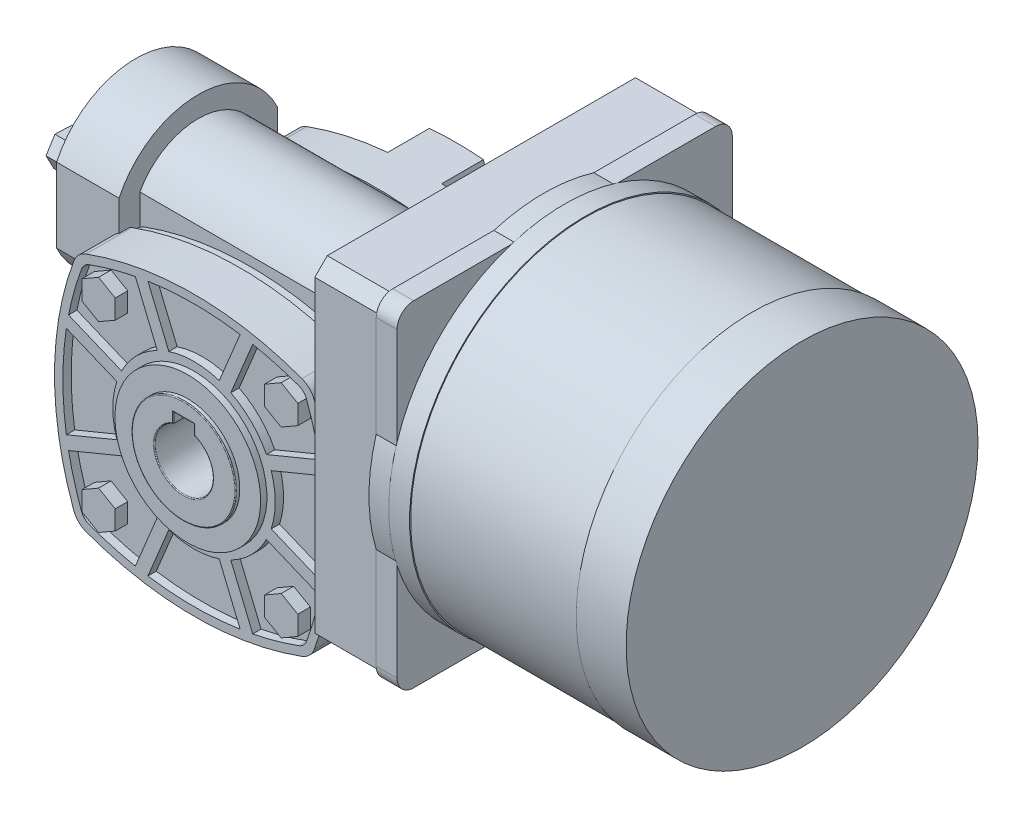
from build123d import *
from build123d.topology import SkipClean

# Parameters (mm, degrees)
SCHIZZO1_R               = 7
ESTRUSIONE1_DEPTH        = 25.5
SCHIZZO2_R               = 7
ESTRUSIONE2_DEPTH        = 10
TAGLIO_ESTRUSIONE1_START = -10
SCHIZZO3_R               = 2.5
SCHIZZO3_R_2             = 21
SCHIZZO3_R_3             = 7
TAGLIO_ESTRUSIONE1_DEPTH = 10
ESTRUSIONE3_START        = 6
SCHIZZO4_R               = 12.5
SCHIZZO4_R_2             = 7
ESTRUSIONE3_DEPTH        = 6
SCHIZZO5_W               = 5
SCHIZZO5_H               = 9
TAGLIO_ESTRUSIONE2_DEPTH = 75.118148925
RACCORDO1_R              = 0.2
ESTRUSIONE4_DEPTH        = 3
SCHIZZO7_R               = 17.5
SCHIZZO7_R_2             = 12.5
ESTRUSIONE5_DEPTH        = 3.5
SCHIZZO8_R               = 12.5
ESTRUSIONE6_DEPTH        = 4.5
RACCORDO2_R              = 0.2
ESTRUSIONE7_START        = 2
SCHIZZO9_R               = 17.5
ESTRUSIONE7_DEPTH        = 2
TAGLIO_ESTRUSIONE3_START = -1.5
TAGLIO_ESTRUSIONE3_DEPTH = 15
TAGLIO_ESTRUSIONE4_START = 16.5
TAGLIO_ESTRUSIONE4_DEPTH = 15
ESTRUSIONE8_DEPTH        = 41.5
ESTRUSIONE8_DEPTH_BACK   = 41.5
ESTRUSIONE9_DEPTH        = 15
ESTRUSIONE10_DEPTH       = 15
SMUSSO1_SIZE             = 3
ESTRUSIONE11_DEPTH       = 3
ESTRUSIONE12_DEPTH       = 3
ESTRUSIONE13_DEPTH       = 15
SCHIZZO20_R              = 42
ESTRUSIONE14_DEPTH       = 62
ESTRUSIONE16_DEPTH       = 5
SCHIZZO23_R              = 42.25
ESTRUSIONE17_DEPTH       = 5
ESTRUSIONE18_START       = -12
SCHIZZO24_R              = 42.25
ESTRUSIONE18_DEPTH       = 12


# Some blends are built 0.0001 mm under size
with BuildPart() as part:
    # Schizzo1 → Estrusione1 (new, symmetric)
    with BuildSketch(Plane.XY):
        with BuildLine():
            ThreePointArc((25.915877081, 28.880162795), (0, 33.5), (-25.915877081, 28.880162795))
            ThreePointArc((-25.915877081, 28.880162795), (-27.723685848, 27.723685848), (-28.880162795, 25.915877081))
            ThreePointArc((-28.880162795, 25.915877081), (-33.5, 0), (-28.880162795, -25.915877081))
            ThreePointArc((-28.880162795, -25.915877081), (-27.723685848, -27.723685848), (-25.915877081, -28.880162795))
            ThreePointArc((-25.915877081, -28.880162795), (0, -33.5), (25.915877081, -28.880162795))
            ThreePointArc((25.915877081, -28.880162795), (27.723685848, -27.723685848), (28.880162795, -25.915877081))
            ThreePointArc((28.880162795, -25.915877081), (33.5, 0), (28.880162795, 25.915877081))
            ThreePointArc((28.880162795, 25.915877081), (27.723685848, 27.723685848), (25.915877081, 28.880162795))
        make_face()
        Circle(SCHIZZO1_R, mode=Mode.SUBTRACT)
    extrude(amount=ESTRUSIONE1_DEPTH, both=True)

    # Schizzo2 → Estrusione2 (add)
    with BuildSketch(Plane(origin=(0, 0, -25.5), x_dir=(-1, 0, 0), z_dir=(0, 0, -1))):
        with BuildLine():
            ThreePointArc((28.880162795, 25.915877081), (27.723685848, 27.723685848), (25.915877081, 28.880162795))
            ThreePointArc((25.915877081, 28.880162795), (0, 33.5), (-25.915877081, 28.880162795))
            ThreePointArc((-25.915877081, 28.880162795), (-27.723685848, 27.723685848), (-28.880162795, 25.915877081))
            ThreePointArc((-28.880162795, 25.915877081), (-33.5, 0), (-28.880162795, -25.915877081))
            ThreePointArc((-28.880162795, -25.915877081), (-27.723685848, -27.723685848), (-25.915877081, -28.880162795))
            ThreePointArc((-25.915877081, -28.880162795), (0, -33.5), (25.915877081, -28.880162795))
            ThreePointArc((25.915877081, -28.880162795), (27.723685848, -27.723685848), (28.880162795, -25.915877081))
            ThreePointArc((28.880162795, -25.915877081), (33.5, 0), (28.880162795, 25.915877081))
        make_face()
        Circle(SCHIZZO2_R, mode=Mode.SUBTRACT)
    extrude(amount=ESTRUSIONE2_DEPTH)

    # Schizzo3 → Taglio-Estrusione1 (cut)
    # profile 1 of 9: a face of its own
    with BuildSketch(Plane(origin=(0, 0, -35.5), x_dir=(-1, 0, 0), z_dir=(0, 0, -1)).offset(TAGLIO_ESTRUSIONE1_START)):
        with Locations((0, 27.5)):
            Circle(SCHIZZO3_R)
    # profile 2 of 9: a face of its own
    with BuildSketch(Plane(origin=(0, 0, -35.5), x_dir=(-1, 0, 0), z_dir=(0, 0, -1)).offset(TAGLIO_ESTRUSIONE1_START)):
        with Locations(Location((0, -27.5, 0), (0, 0, 180))):
            Circle(SCHIZZO3_R)
    # profile 3 of 9: a face of its own
    with BuildSketch(Plane(origin=(0, 0, -35.5), x_dir=(-1, 0, 0), z_dir=(0, 0, -1)).offset(TAGLIO_ESTRUSIONE1_START)):
        with Locations((-27.5, 0)):
            Circle(SCHIZZO3_R)
    # profile 4 of 9: a face of its own
    with BuildSketch(Plane(origin=(0, 0, -35.5), x_dir=(-1, 0, 0), z_dir=(0, 0, -1)).offset(TAGLIO_ESTRUSIONE1_START)):
        with Locations(Location((27.5, 0, 0), (0, 0, 180))):
            Circle(SCHIZZO3_R)
    # profile 5 of 9: a face of its own
    with BuildSketch(Plane(origin=(0, 0, -35.5), x_dir=(-1, 0, 0), z_dir=(0, 0, -1)).offset(TAGLIO_ESTRUSIONE1_START)):
        Circle(SCHIZZO3_R_2)
        Circle(SCHIZZO3_R_3, mode=Mode.SUBTRACT)
    # profile 6 of 9: a face of its own
    with BuildSketch(Plane(origin=(0, 0, -35.5), x_dir=(-1, 0, 0), z_dir=(0, 0, -1)).offset(TAGLIO_ESTRUSIONE1_START)):
        with BuildLine():
            Line((-6.5, 33.21780243), (-9.828937879, 20.79403713))
            ThreePointArc((-9.828937879, 20.79403713), (-16.263455967, 16.263455967), (-20.79403713, 9.828937879))
            Line((-20.79403713, 9.828937879), (-33.21780243, 6.5))
            ThreePointArc((-33.21780243, 6.5), (-31.695621104, 16.352401999), (-28.880162795, 25.915877081))
            ThreePointArc((-28.880162795, 25.915877081), (-27.723685848, 27.723685848), (-25.915877081, 28.880162795))
            ThreePointArc((-25.915877081, 28.880162795), (-16.352401999, 31.695621104), (-6.5, 33.21780243))
        make_face()
    # profile 7 of 9: a face of its own
    with BuildSketch(Plane(origin=(0, 0, -35.5), x_dir=(-1, 0, 0), z_dir=(0, 0, -1)).offset(TAGLIO_ESTRUSIONE1_START)):
        with BuildLine():
            Line((6.5, 33.21780243), (9.828937879, 20.79403713))
            ThreePointArc((9.828937879, 20.79403713), (16.263455967, 16.263455967), (20.79403713, 9.828937879))
            Line((20.79403713, 9.828937879), (33.21780243, 6.5))
            ThreePointArc((33.21780243, 6.5), (31.695621104, 16.352401999), (28.880162795, 25.915877081))
            ThreePointArc((28.880162795, 25.915877081), (27.723685848, 27.723685848), (25.915877081, 28.880162795))
            ThreePointArc((25.915877081, 28.880162795), (16.352401999, 31.695621104), (6.5, 33.21780243))
        make_face()
    # profile 8 of 9: a face of its own
    with BuildSketch(Plane(origin=(0, 0, -35.5), x_dir=(-1, 0, 0), z_dir=(0, 0, -1)).offset(TAGLIO_ESTRUSIONE1_START)):
        with BuildLine():
            Line((-6.5, -33.21780243), (-9.828937879, -20.79403713))
            ThreePointArc((-9.828937879, -20.79403713), (-16.263455967, -16.263455967), (-20.79403713, -9.828937879))
            Line((-20.79403713, -9.828937879), (-33.21780243, -6.5))
            ThreePointArc((-33.21780243, -6.5), (-31.695621104, -16.352401999), (-28.880162795, -25.915877081))
            ThreePointArc((-28.880162795, -25.915877081), (-27.723685848, -27.723685848), (-25.915877081, -28.880162795))
            ThreePointArc((-25.915877081, -28.880162795), (-16.352401999, -31.695621104), (-6.5, -33.21780243))
        make_face()
    # profile 9 of 9: a face of its own
    with BuildSketch(Plane(origin=(0, 0, -35.5), x_dir=(-1, 0, 0), z_dir=(0, 0, -1)).offset(TAGLIO_ESTRUSIONE1_START)):
        with BuildLine():
            Line((6.5, -33.21780243), (9.828937879, -20.79403713))
            ThreePointArc((9.828937879, -20.79403713), (16.263455967, -16.263455967), (20.79403713, -9.828937879))
            Line((20.79403713, -9.828937879), (33.21780243, -6.5))
            ThreePointArc((33.21780243, -6.5), (31.695621104, -16.352401999), (28.880162795, -25.915877081))
            ThreePointArc((28.880162795, -25.915877081), (27.723685848, -27.723685848), (25.915877081, -28.880162795))
            ThreePointArc((25.915877081, -28.880162795), (16.352401999, -31.695621104), (6.5, -33.21780243))
        make_face()
    extrude(amount=TAGLIO_ESTRUSIONE1_DEPTH, mode=Mode.SUBTRACT)

    # Schizzo4 → Estrusione3 (add)
    with SkipClean():  # the faces are left unmerged after this step: merging them gives an invalid solid
        with BuildSketch(Plane(origin=(0, 0, -25.5), x_dir=(-1, 0, 0), z_dir=(0, 0, -1)).offset(ESTRUSIONE3_START)):
            Circle(SCHIZZO4_R)
            Circle(SCHIZZO4_R_2, mode=Mode.SUBTRACT)
        extrude(amount=-ESTRUSIONE3_DEPTH)

    # Schizzo5 → Taglio-Estrusione2 (cut, through all)
    with SkipClean():  # the faces are left unmerged after this step: merging them gives an invalid solid
        with BuildSketch(Plane(origin=(0, 0, -31.5), x_dir=(-1, 0, 0), z_dir=(0, 0, -1))):
            with Locations((0, 4.5)):
                Rectangle(SCHIZZO5_W, SCHIZZO5_H)
        extrude(amount=-TAGLIO_ESTRUSIONE2_DEPTH, mode=Mode.SUBTRACT)
    add(part.part.scale(1), mode=Mode.REPLACE)  # the faces are merged on a copy

    # Raccordo1
    raccordo1_edges = [part.edges().sort_by_distance(p)[0] for p in [
        (12.5, 0, -31.5),
        (3.968626967, -5.766281297, -31.5),
    ]]
    fillet(raccordo1_edges, radius=RACCORDO1_R)

    # Schizzo6 → Estrusione4 (add)
    with BuildSketch(Plane(origin=(0, 0, -25.5), x_dir=(-1, 0, 0), z_dir=(0, 0, -1))):
        Polygon((25.920310217, 19.61090914), (21.920310217, 17.301508063), (17.920310217, 19.61090914), (17.920310217, 24.229711294), (21.920310217, 26.53911237), (25.920310217, 24.229711294), align=None)
        Polygon((-21.920310217, 17.301508063), (-17.920310217, 19.61090914), (-17.920310217, 24.229711294), (-21.920310217, 26.53911237), (-25.920310217, 24.229711294), (-25.920310217, 19.61090914), align=None)
        Polygon((21.920310217, -17.301508063), (17.920310217, -19.61090914), (17.920310217, -24.229711294), (21.920310217, -26.53911237), (25.920310217, -24.229711294), (25.920310217, -19.61090914), align=None)
        Polygon((-25.920310217, -19.61090914), (-21.920310217, -17.301508063), (-17.920310217, -19.61090914), (-17.920310217, -24.229711294), (-21.920310217, -26.53911237), (-25.920310217, -24.229711294), align=None)
    extrude(amount=ESTRUSIONE4_DEPTH)

    # Schizzo7 → Estrusione5 (add)
    with BuildSketch(Plane.XY.offset(25.5)):
        with Locations(Location((0, 0, 0), (0, 0, 180))):
            Circle(SCHIZZO7_R)
        with Locations(Location((0, 0, 0), (0, 0, 180))):
            Circle(SCHIZZO7_R_2, mode=Mode.SUBTRACT)
    extrude(amount=ESTRUSIONE5_DEPTH)

    # Schizzo8 → Estrusione6 (add)
    with BuildSketch(Plane.XY.offset(25.5)):
        with Locations(Location((0, 0, 0), (0, 0, 180))):
            Circle(SCHIZZO8_R)
        with BuildLine():
            Line((2.5, 9), (2.5, 6.538348415))
            ThreePointArc((2.5, 6.538348415), (0, -7), (-2.5, 6.538348415))
            Line((-2.5, 6.538348415), (-2.5, 9))
            Line((-2.5, 9), (2.5, 9))
        make_face(mode=Mode.SUBTRACT)
    extrude(amount=ESTRUSIONE6_DEPTH)

    # Raccordo2
    # the kernel refuses this fillet: 0.2 mm, written as the material it takes off along each edge
    with BuildSketch(Plane(origin=(0, 0, 30), x_dir=(-1, 0, 0), z_dir=(0, 1, 0))) as raccordo2_piece_1:
        with BuildLine():
            CenterArc((12.5 - RACCORDO2_R, -RACCORDO2_R), RACCORDO2_R, 0, 90)
            Line((12.5, -RACCORDO2_R), (12.5, 0))
            Line((12.5, 0), (12.5 - RACCORDO2_R, 0))
        make_face()
    revolve(axis=Axis((0, 0, 30), (0, 0, 1)), mode=Mode.SUBTRACT)
    with BuildSketch(Plane(origin=(-2.5, 9, 30), x_dir=(0, 0, -1), z_dir=(1, 0, 0))) as raccordo2_piece_2:
        with BuildLine():
            CenterArc((RACCORDO2_R, RACCORDO2_R), RACCORDO2_R, 180, 90)
            Line((0, RACCORDO2_R), (0, 0))
            Line((0, 0), (RACCORDO2_R, 0))
        make_face()
    extrude(amount=5, mode=Mode.SUBTRACT)
    with BuildSketch(Plane(origin=(-2.5, 6.038348415, 30), x_dir=(0, 0, -1), z_dir=(0, 1, 0)), Plane(origin=(2.5, 9, 30), x_dir=(0, 0, -1), z_dir=(0, -1, 0))) as raccordo2_piece_3:
        with BuildLine():
            CenterArc((RACCORDO2_R, RACCORDO2_R), RACCORDO2_R, 180, 90)
            Line((0, RACCORDO2_R), (0, 0))
            Line((0, 0), (RACCORDO2_R, 0))
        make_face()
    extrude(amount=2.961651585, mode=Mode.SUBTRACT)
    with BuildSketch(Plane(origin=(0, 0, 30), x_dir=(0.2892267133051711, 0.9572606271599644, 0), z_dir=(-0.9572606271599644, 0.2892267133051711, 0))) as raccordo2_piece_4:
        with BuildLine():
            CenterArc((7 + RACCORDO2_R, RACCORDO2_R), RACCORDO2_R, 180, 90)
            Line((7, RACCORDO2_R), (7, 0))
            Line((7, 0), (7 + RACCORDO2_R, 0))
        make_face()
    revolve(axis=Axis((0, 0, 30), (0, 0, -1)), revolution_arc=326.37666771, mode=Mode.SUBTRACT)
    with BuildSketch(Plane(origin=(-3, 9, 30), x_dir=(0, 0, -1), z_dir=(1, 0, 0))) as raccordo2_piece_5a_section:
        with BuildLine():
            CenterArc((RACCORDO2_R, RACCORDO2_R), RACCORDO2_R, 180, 90)
            Line((0, RACCORDO2_R), (0, 0))
            Line((0, 0), (RACCORDO2_R, 0))
        make_face()
    raccordo2_piece_5a = extrude(amount=5.5, mode=Mode.PRIVATE)
    raccordo2_piece_5a = split(raccordo2_piece_5a, bisect_by=Plane(origin=(-2.5, 9.045279023, 29.954720977), z_dir=(-1, 0, 0)), keep=Keep.TOP, mode=Mode.PRIVATE)
    with BuildSketch(Plane(origin=(-2.5, 6.038348415, 30), x_dir=(0, 0, -1), z_dir=(0, 1, 0))) as raccordo2_piece_5b_section:
        with BuildLine():
            CenterArc((RACCORDO2_R, RACCORDO2_R), RACCORDO2_R, 180, 90)
            Line((0, RACCORDO2_R), (0, 0))
            Line((0, 0), (RACCORDO2_R, 0))
        make_face()
    raccordo2_piece_5b = extrude(amount=3.461651585, mode=Mode.PRIVATE)
    raccordo2_piece_5b = split(raccordo2_piece_5b, bisect_by=Plane(origin=(-2.545279023, 9, 29.954720977), z_dir=(0, 1, 0)), keep=Keep.TOP, mode=Mode.PRIVATE)
    raccordo2_piece_5 = raccordo2_piece_5a & raccordo2_piece_5b
    add(raccordo2_piece_5, mode=Mode.SUBTRACT)
    with BuildSketch(Plane(origin=(2.5, 9.5, 30), x_dir=(0, 0, -1), z_dir=(0, -1, 0))) as raccordo2_piece_6a_section:
        with BuildLine():
            CenterArc((RACCORDO2_R, RACCORDO2_R), RACCORDO2_R, 180, 90)
            Line((0, RACCORDO2_R), (0, 0))
            Line((0, 0), (RACCORDO2_R, 0))
        make_face()
    raccordo2_piece_6a = extrude(amount=3.461651585, mode=Mode.PRIVATE)
    raccordo2_piece_6a = split(raccordo2_piece_6a, bisect_by=Plane(origin=(2.545279023, 9, 29.954720977), z_dir=(0, 1, 0)), keep=Keep.TOP, mode=Mode.PRIVATE)
    with BuildSketch(Plane(origin=(-2.5, 9, 30), x_dir=(0, 0, -1), z_dir=(1, 0, 0))) as raccordo2_piece_6b_section:
        with BuildLine():
            CenterArc((RACCORDO2_R, RACCORDO2_R), RACCORDO2_R, 180, 90)
            Line((0, RACCORDO2_R), (0, 0))
            Line((0, 0), (RACCORDO2_R, 0))
        make_face()
    raccordo2_piece_6b = extrude(amount=5.5, mode=Mode.PRIVATE)
    raccordo2_piece_6b = split(raccordo2_piece_6b, bisect_by=Plane(origin=(2.5, 9.045279023, 29.954720977), z_dir=(1, 0, 0)), keep=Keep.TOP, mode=Mode.PRIVATE)
    raccordo2_piece_6 = raccordo2_piece_6a & raccordo2_piece_6b
    add(raccordo2_piece_6, mode=Mode.SUBTRACT)

    # Schizzo9 → Estrusione7 (add)
    with BuildSketch(Plane.XY.offset(25.5).offset(ESTRUSIONE7_START)):
        with BuildLine():
            ThreePointArc((-25.915877081, 28.880162795), (-27.723685848, 27.723685848), (-28.880162795, 25.915877081))
            ThreePointArc((-28.880162795, 25.915877081), (-33.5, 0), (-28.880162795, -25.915877081))
            ThreePointArc((-28.880162795, -25.915877081), (-27.723685848, -27.723685848), (-25.915877081, -28.880162795))
            ThreePointArc((-25.915877081, -28.880162795), (0, -33.5), (25.915877081, -28.880162795))
            ThreePointArc((25.915877081, -28.880162795), (27.723685848, -27.723685848), (28.880162795, -25.915877081))
            ThreePointArc((28.880162795, -25.915877081), (33.5, 0), (28.880162795, 25.915877081))
            ThreePointArc((28.880162795, 25.915877081), (27.723685848, 27.723685848), (25.915877081, 28.880162795))
            ThreePointArc((25.915877081, 28.880162795), (0, 33.5), (-25.915877081, 28.880162795))
        make_face()
        Circle(SCHIZZO9_R, mode=Mode.SUBTRACT)
        with BuildLine():
            Line((-14.101770277, 30.124996161), (-8.826035583, 17.388245912))
            ThreePointArc((-8.826035583, 17.388245912), (-13.788582233, 13.788582233), (-17.388245912, 8.826035583))
            Line((-17.388245912, 8.826035583), (-30.124996161, 14.101770277))
            ThreePointArc((-30.124996161, 14.101770277), (-28.784559593, 19.725128208), (-27.003358454, 25.224787026))
            ThreePointArc((-27.003358454, 25.224787026), (-26.309472286, 26.309472286), (-25.224787026, 27.003358454))
            ThreePointArc((-25.224787026, 27.003358454), (-19.725128208, 28.784559593), (-14.101770277, 30.124996161))
        make_face(mode=Mode.SUBTRACT)
        with BuildLine():
            Line((11.074181495, 30.655128052), (6.054396985, 18.536296209))
            ThreePointArc((6.054396985, 18.536296209), (0, 19.5), (-6.054396985, 18.536296209))
            Line((-6.054396985, 18.536296209), (-11.074181495, 30.655128052))
            ThreePointArc((-11.074181495, 30.655128052), (0, 31.5), (11.074181495, 30.655128052))
        make_face(mode=Mode.SUBTRACT)
        with BuildLine():
            Line((14.101770277, 30.124996161), (8.826035583, 17.388245912))
            ThreePointArc((8.826035583, 17.388245912), (13.788582233, 13.788582233), (17.388245912, 8.826035583))
            Line((17.388245912, 8.826035583), (30.124996161, 14.101770277))
            ThreePointArc((30.124996161, 14.101770277), (28.784559593, 19.725128208), (27.003358454, 25.224787026))
            ThreePointArc((27.003358454, 25.224787026), (26.309472286, 26.309472286), (25.224787026, 27.003358454))
            ThreePointArc((25.224787026, 27.003358454), (19.725128208, 28.784559593), (14.101770277, 30.124996161))
        make_face(mode=Mode.SUBTRACT)
        with BuildLine():
            Line((14.101770277, -30.124996161), (8.826035583, -17.388245912))
            ThreePointArc((8.826035583, -17.388245912), (13.788582233, -13.788582233), (17.388245912, -8.826035583))
            Line((17.388245912, -8.826035583), (30.124996161, -14.101770277))
            ThreePointArc((30.124996161, -14.101770277), (28.784559593, -19.725128208), (27.003358454, -25.224787026))
            ThreePointArc((27.003358454, -25.224787026), (26.309472286, -26.309472286), (25.224787026, -27.003358454))
            ThreePointArc((25.224787026, -27.003358454), (19.725128208, -28.784559593), (14.101770277, -30.124996161))
        make_face(mode=Mode.SUBTRACT)
        with BuildLine():
            Line((-11.074181495, -30.655128052), (-6.054396985, -18.536296209))
            ThreePointArc((-6.054396985, -18.536296209), (0, -19.5), (6.054396985, -18.536296209))
            Line((6.054396985, -18.536296209), (11.074181495, -30.655128052))
            ThreePointArc((11.074181495, -30.655128052), (0, -31.5), (-11.074181495, -30.655128052))
        make_face(mode=Mode.SUBTRACT)
        with BuildLine():
            Line((-14.101770277, -30.124996161), (-8.826035583, -17.388245912))
            ThreePointArc((-8.826035583, -17.388245912), (-13.788582233, -13.788582233), (-17.388245912, -8.826035583))
            Line((-17.388245912, -8.826035583), (-30.124996161, -14.101770277))
            ThreePointArc((-30.124996161, -14.101770277), (-28.784559593, -19.725128208), (-27.003358454, -25.224787026))
            ThreePointArc((-27.003358454, -25.224787026), (-26.309472286, -26.309472286), (-25.224787026, -27.003358454))
            ThreePointArc((-25.224787026, -27.003358454), (-19.725128208, -28.784559593), (-14.101770277, -30.124996161))
        make_face(mode=Mode.SUBTRACT)
        with BuildLine():
            Line((-30.655128052, 11.074181495), (-18.536296209, 6.054396985))
            ThreePointArc((-18.536296209, 6.054396985), (-19.5, 0), (-18.536296209, -6.054396985))
            Line((-18.536296209, -6.054396985), (-30.655128052, -11.074181495))
            ThreePointArc((-30.655128052, -11.074181495), (-31.5, 0), (-30.655128052, 11.074181495))
        make_face(mode=Mode.SUBTRACT)
        with BuildLine():
            Line((30.655128052, -11.074181495), (18.536296209, -6.054396985))
            ThreePointArc((18.536296209, -6.054396985), (19.5, 0), (18.536296209, 6.054396985))
            Line((18.536296209, 6.054396985), (30.655128052, 11.074181495))
            ThreePointArc((30.655128052, 11.074181495), (31.5, 0), (30.655128052, -11.074181495))
        make_face(mode=Mode.SUBTRACT)
    extrude(amount=-ESTRUSIONE7_DEPTH)

    # Schizzo11 → Taglio-Estrusione3 (cut)
    with BuildSketch(Plane.XY.offset(TAGLIO_ESTRUSIONE3_START)):
        with BuildLine():
            ThreePointArc((36.627772941, 57.970630084), (0, 64.5), (-36.627772941, 57.970630084))
            ThreePointArc((-36.627772941, 57.970630084), (-49.643996065, 49.643996065), (-57.970630084, 36.627772941))
            ThreePointArc((-57.970630084, 36.627772941), (-64.5, 0), (-57.970630084, -36.627772941))
            ThreePointArc((-57.970630084, -36.627772941), (-49.643996065, -49.643996065), (-36.627772941, -57.970630084))
            ThreePointArc((-36.627772941, -57.970630084), (0, -64.5), (36.627772941, -57.970630084))
            ThreePointArc((36.627772941, -57.970630084), (49.643996065, -49.643996065), (57.970630084, -36.627772941))
            ThreePointArc((57.970630084, -36.627772941), (64.5, 0), (57.970630084, 36.627772941))
            ThreePointArc((57.970630084, 36.627772941), (49.643996065, 49.643996065), (36.627772941, 57.970630084))
        make_face()
        with BuildLine():
            ThreePointArc((25.570332053, 27.941760625), (0, 32.5), (-25.570332053, 27.941760625))
            ThreePointArc((-25.570332053, 27.941760625), (-27.016579067, 27.016579067), (-27.941760625, 25.570332053))
            ThreePointArc((-27.941760625, 25.570332053), (-32.5, 0), (-27.941760625, -25.570332053))
            ThreePointArc((-27.941760625, -25.570332053), (-27.016579067, -27.016579067), (-25.570332053, -27.941760625))
            ThreePointArc((-25.570332053, -27.941760625), (0, -32.5), (25.570332053, -27.941760625))
            ThreePointArc((25.570332053, -27.941760625), (27.016579067, -27.016579067), (27.941760625, -25.570332053))
            ThreePointArc((27.941760625, -25.570332053), (32.5, 0), (27.941760625, 25.570332053))
            ThreePointArc((27.941760625, 25.570332053), (27.016579067, 27.016579067), (25.570332053, 27.941760625))
        make_face(mode=Mode.SUBTRACT)
    extrude(amount=-TAGLIO_ESTRUSIONE3_DEPTH, mode=Mode.SUBTRACT)

    # Schizzo12 → Taglio-Estrusione4 (cut)
    with BuildSketch(Plane.XY.offset(TAGLIO_ESTRUSIONE4_START)):
        with BuildLine():
            ThreePointArc((29.716872386, 39.202586672), (0, 44.5), (-29.716872386, 39.202586672))
            ThreePointArc((-29.716872386, 39.202586672), (-35.501860441, 35.501860441), (-39.202586672, 29.716872386))
            ThreePointArc((-39.202586672, 29.716872386), (-44.5, 0), (-39.202586672, -29.716872386))
            ThreePointArc((-39.202586672, -29.716872386), (-35.501860441, -35.501860441), (-29.716872386, -39.202586672))
            ThreePointArc((-29.716872386, -39.202586672), (0, -44.5), (29.716872386, -39.202586672))
            ThreePointArc((29.716872386, -39.202586672), (35.501860441, -35.501860441), (39.202586672, -29.716872386))
            ThreePointArc((39.202586672, -29.716872386), (44.5, 0), (39.202586672, 29.716872386))
            ThreePointArc((39.202586672, 29.716872386), (35.501860441, 35.501860441), (29.716872386, 39.202586672))
        make_face()
        with BuildLine():
            ThreePointArc((25.570332053, 27.941760625), (0, 32.5), (-25.570332053, 27.941760625))
            ThreePointArc((-25.570332053, 27.941760625), (-27.016579067, 27.016579067), (-27.941760625, 25.570332053))
            ThreePointArc((-27.941760625, 25.570332053), (-32.5, 0), (-27.941760625, -25.570332053))
            ThreePointArc((-27.941760625, -25.570332053), (-27.016579067, -27.016579067), (-25.570332053, -27.941760625))
            ThreePointArc((-25.570332053, -27.941760625), (0, -32.5), (25.570332053, -27.941760625))
            ThreePointArc((25.570332053, -27.941760625), (27.016579067, -27.016579067), (27.941760625, -25.570332053))
            ThreePointArc((27.941760625, -25.570332053), (32.5, 0), (27.941760625, 25.570332053))
            ThreePointArc((27.941760625, 25.570332053), (27.016579067, 27.016579067), (25.570332053, 27.941760625))
        make_face(mode=Mode.SUBTRACT)
    extrude(amount=-TAGLIO_ESTRUSIONE4_DEPTH, mode=Mode.SUBTRACT)

    # Schizzo13 → Estrusione8 (add, two sides: drawn at the far end of the back side and taken through both)
    with BuildSketch(Plane(origin=(0, 0, 0), x_dir=(0, 0, -1), z_dir=(1, 0, 0)).offset(-ESTRUSIONE8_DEPTH_BACK)):
        with BuildLine():
            Line((14, 34.745966692), (14, 19.254033308))
            ThreePointArc((14, 19.254033308), (0, 11), (-14, 19.254033308))
            Line((-14, 19.254033308), (-14, 34.745966692))
            ThreePointArc((-14, 34.745966692), (0, 43), (14, 34.745966692))
        make_face()
    extrude(amount=ESTRUSIONE8_DEPTH + ESTRUSIONE8_DEPTH_BACK)

    # Schizzo15 → Estrusione9 (add)
    with BuildSketch(Plane.ZY.offset(41.5)):
        with BuildLine():
            Line((19, 18.05572809), (19, 35.94427191))
            ThreePointArc((19, 35.94427191), (0, 48), (-19, 35.94427191))
            Line((-19, 35.94427191), (-19, 18.05572809))
            ThreePointArc((-19, 18.05572809), (0, 6), (19, 18.05572809))
        make_face()
    extrude(amount=-ESTRUSIONE9_DEPTH)

    # Schizzo16 → Estrusione10 (add)
    with BuildSketch(Plane(origin=(41.5, 0, 0), x_dir=(0, 0, -1), z_dir=(1, 0, 0))):
        with BuildLine():
            Line((-16, 46), (16, 46))
            ThreePointArc((16, 46), (18.121320344, 45.121320344), (19, 43))
            Line((19, 43), (19, 11))
            ThreePointArc((19, 11), (18.121320344, 8.878679656), (16, 8))
            Line((16, 8), (-16, 8))
            ThreePointArc((-16, 8), (-18.121320344, 8.878679656), (-19, 11))
            Line((-19, 11), (-19, 43))
            ThreePointArc((-19, 43), (-18.121320344, 45.121320344), (-16, 46))
        make_face()
    extrude(amount=-ESTRUSIONE10_DEPTH)

    # Smusso1
    smusso1_edges = [part.edges().sort_by_distance(p)[0] for p in [
        (26.5, 35.810794185, -19),
        (26.5, 35.810794185, 19),
        (26.5, 45.121320344, -18.121320344),
        (26.5, 45.121320344, 18.121320344),
        (26.5, 46, 0),
    ]]
    chamfer(smusso1_edges, length=SMUSSO1_SIZE - 0.0001)  # a hair under: the kernel refuses the full size

    # Schizzo17 → Estrusione11 (add)
    with BuildSketch(Plane.ZY.offset(41.5)):
        Polygon((16.657899271, 31.954131356), (12.619353243, 31.800901736), (10.467379486, 35.22177038), (12.353951756, 38.795868644), (16.392497784, 38.949098264), (18.544471541, 35.52822962), align=None)
        Polygon((-12.619353243, 31.800901736), (-10.467379486, 35.22177038), (-12.353951756, 38.795868644), (-16.392497784, 38.949098264), (-18.544471541, 35.52822962), (-16.657899271, 31.954131356), align=None)
        Polygon((0, 6.208548116), (3.5, 8.229274058), (3.5, 12.270725942), (0, 14.291451884), (-3.5, 12.270725942), (-3.5, 8.229274058), align=None)
    extrude(amount=ESTRUSIONE11_DEPTH)

    # Schizzo18 → Estrusione12 (add)
    with BuildSketch(Plane.XY.offset(25.5)):
        Polygon((-21.920310217, -26.53911237), (-25.920310217, -24.229711294), (-25.920310217, -19.61090914), (-21.920310217, -17.301508063), (-17.920310217, -19.61090914), (-17.920310217, -24.229711294), align=None)
        Polygon((25.920310217, -19.61090914), (25.920310217, -24.229711294), (21.920310217, -26.53911237), (17.920310217, -24.229711294), (17.920310217, -19.61090914), (21.920310217, -17.301508063), align=None)
        Polygon((21.920310217, 26.53911237), (25.920310217, 24.229711294), (25.920310217, 19.61090914), (21.920310217, 17.301508063), (17.920310217, 19.61090914), (17.920310217, 24.229711294), align=None)
        Polygon((-21.920310217, 17.301508063), (-25.920310217, 19.61090914), (-25.920310217, 24.229711294), (-21.920310217, 26.53911237), (-17.920310217, 24.229711294), (-17.920310217, 19.61090914), align=None)
    extrude(amount=ESTRUSIONE12_DEPTH)

    # Schizzo19 → Estrusione13 (add)
    with BuildSketch(Plane(origin=(41.5, 0, 0), x_dir=(0, 0, -1), z_dir=(1, 0, 0))):
        Polygon((37, 67), (40, 64), (40, -10), (37, -13), (-37, -13), (-40, -10), (-40, 64), (-37, 67), align=None)
    extrude(amount=ESTRUSIONE13_DEPTH)

    # Schizzo20 → Estrusione14 (add)
    with BuildSketch(Plane(origin=(56.5, 0, 0), x_dir=(0, 0, -1), z_dir=(1, 0, 0))):
        with Locations(Location((0, 27, 0), (0, 0, 162.247209838))):
            Circle(SCHIZZO20_R)
    extrude(amount=ESTRUSIONE14_DEPTH)

    # Schizzo21 → Estrusione16 (add)
    with BuildSketch(Plane(origin=(56.5, 0, 0), x_dir=(0, 0, -1), z_dir=(1, 0, 0))):
        with BuildLine():
            Line((-36.25, 67.25), (36.25, 67.25))
            ThreePointArc((36.25, 67.25), (39.078427125, 66.078427125), (40.25, 63.25))
            Line((40.25, 63.25), (40.25, -9.25))
            ThreePointArc((40.25, -9.25), (39.078427125, -12.078427125), (36.25, -13.25))
            Line((36.25, -13.25), (-36.25, -13.25))
            ThreePointArc((-36.25, -13.25), (-39.078427125, -12.078427125), (-40.25, -9.25))
            Line((-40.25, -9.25), (-40.25, 63.25))
            ThreePointArc((-40.25, 63.25), (-39.078427125, 66.078427125), (-36.25, 67.25))
        make_face()
    extrude(amount=ESTRUSIONE16_DEPTH)

    # Schizzo23 → Estrusione17 (add)
    with BuildSketch(Plane(origin=(61.5, 0, 0), x_dir=(0, 0, -1), z_dir=(1, 0, 0))):
        with Locations(Location((0, 27, 0), (0, 0, 162.300233803))):
            Circle(SCHIZZO23_R)
    extrude(amount=ESTRUSIONE17_DEPTH)

    # Schizzo24 → Estrusione18 (add)
    with BuildSketch(Plane(origin=(118.5, 0, 0), x_dir=(0, 0, -1), z_dir=(1, 0, 0)).offset(ESTRUSIONE18_START)):
        with Locations(Location((0, 27, 0), (0, 0, 162.300233803))):
            Circle(SCHIZZO24_R)
    extrude(amount=ESTRUSIONE18_DEPTH)


solid = part.part
